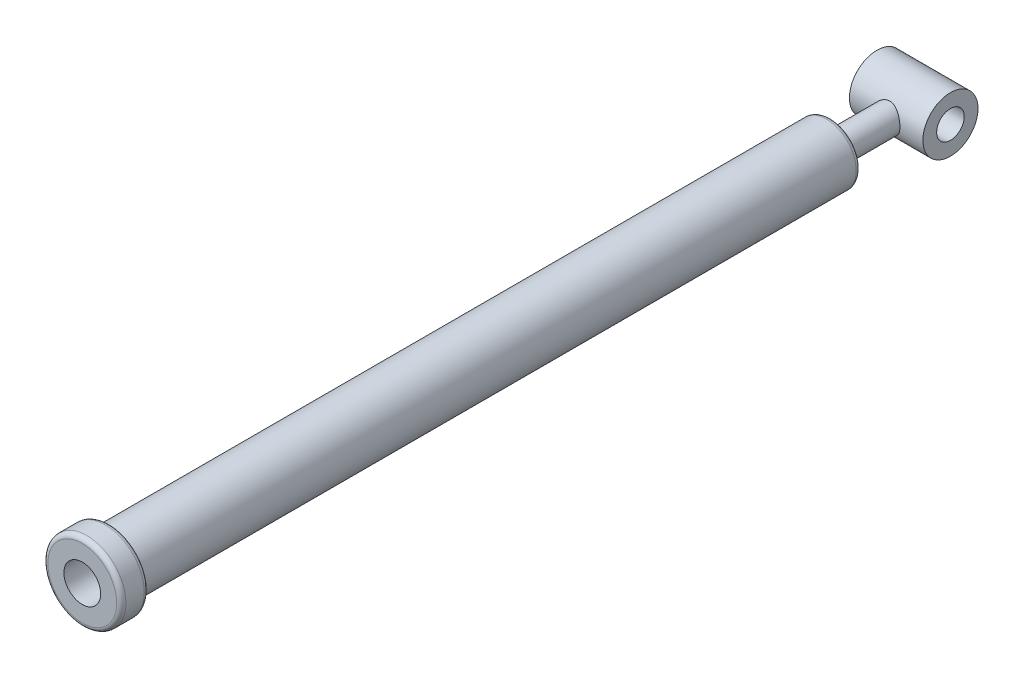
from build123d import *

# Parameters (mm, degrees)
SKETCH1_R           = 42.5
SKETCH1_R_2         = 20
BOSS_EXTRUDE1_DEPTH = 30
SKETCH2_R           = 32.5
SKETCH2_R_2         = 20
BOSS_EXTRUDE2_DEPTH = 780
SKETCH6_R           = 32.5
BOSS_EXTRUDE3_DEPTH = 5
SKETCH7_R           = 15
BOSS_EXTRUDE4_DEPTH = 65
SKETCH8_R           = 30
SKETCH8_R_2         = 15
BOSS_EXTRUDE5_DEPTH = 40
FILLET2_R           = 5


with BuildPart() as part:
    # Sketch1 → Boss-Extrude1 (new body)
    with BuildSketch(Plane.XY):
        Circle(SKETCH1_R)
        Circle(SKETCH1_R_2, mode=Mode.SUBTRACT)
    extrude(amount=-BOSS_EXTRUDE1_DEPTH)

    # Sketch2 → Boss-Extrude2 (add)
    with BuildSketch(Plane(origin=(0, 0, -30), x_dir=(-1, 0, 0), z_dir=(0, 0, -1))):
        with Locations(Location((0, 0, 0), (0, 0, 180))):
            Circle(SKETCH2_R)
        with Locations(Location((0, 0, 0), (0, 0, 180))):
            Circle(SKETCH2_R_2, mode=Mode.SUBTRACT)
    extrude(amount=BOSS_EXTRUDE2_DEPTH)

    # Sketch6 → Boss-Extrude3 (add)
    with BuildSketch(Plane(origin=(0, 0, -810), x_dir=(-1, 0, 0), z_dir=(0, 0, -1))):
        with Locations(Location((0, 0, 0), (0, 0, 180))):
            Circle(SKETCH6_R)
    extrude(amount=BOSS_EXTRUDE3_DEPTH)

    # Sketch7 → Boss-Extrude4 (add)
    with BuildSketch(Plane(origin=(0, 0, -815), x_dir=(-1, 0, 0), z_dir=(0, 0, -1))):
        Circle(SKETCH7_R)
    extrude(amount=BOSS_EXTRUDE4_DEPTH)

    # Sketch8 → Boss-Extrude5 (add, symmetric)
    with BuildSketch(Plane(origin=(0, 0, 0), x_dir=(0, 0, -1), z_dir=(1, 0, 0))):
        with Locations((905, 0)):
            Circle(SKETCH8_R)
        with Locations((905, 0)):
            Circle(SKETCH8_R_2, mode=Mode.SUBTRACT)
    extrude(amount=BOSS_EXTRUDE5_DEPTH, both=True)

    # Fillet2
    fillet2_edges = [part.edges().sort_by_distance(p)[0] for p in [
        (-32.5, 0, -815),
        (-42.5, 0, 0),
        (-42.5, 0, -30),
    ]]
    fillet(fillet2_edges, radius=FILLET2_R - 0.0001)  # a hair under: the kernel refuses the full size


solid = part.part
